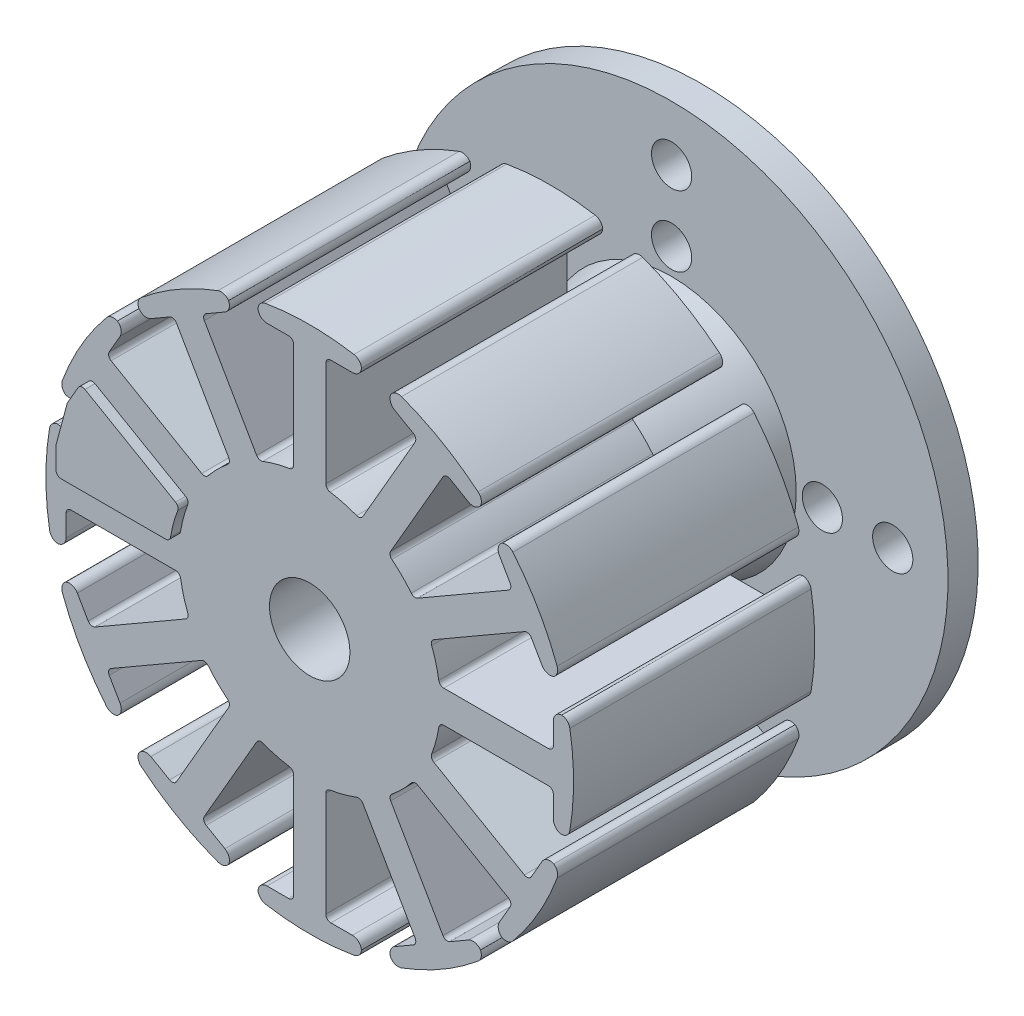
from build123d import *

# Parameters (mm, degrees)
SKETCH_1_R          = 4
EXTRUDE_1_DEPTH     = 24
FILLET_1_R          = 0.9
FILLET_2_R          = 0.9
FILLET_3_R          = 0.9
FILLET_4_R          = 0.9
FILLET_5_R          = 0.5
FILLET_6_R          = 0.5
SKETCH_6_R          = 27.5
EXTRUDE_3_DEPTH     = 3
CUT_EXTRUDE_1_REACH = 57.077
SKETCH_7_R          = 2
SKETCH_8_R          = 10.6
CUT_EXTRUDE_2_DEPTH = 1
SKETCH_9_R          = 4
CUT_EXTRUDE_3_DEPTH = 55.373706881
EXTRUDE_4_DEPTH     = 1


with BuildPart() as part:
    # ｽｹｯﾁ1 → ﾎﾞｽ - 押し出し1 (new body)
    with BuildSketch(Plane.XY):
        with BuildLine():
            Line((-1.6, 24.239852369), (-1.6, 12.901162738))
            ThreePointArc((-1.6, 12.901162738), (-3.364647586, 12.557035742), (-5.064940723, 11.97273467))
            Line((-5.064940723, 11.97273467), (-10.734285539, 21.792327936))
            Line((-10.734285539, 21.792327936), (-7.659895355, 23.567327936))
            Line((-7.659895355, 23.567327936), (-8.409895355, 24.866366042))
            ThreePointArc((-8.409895355, 24.866366042), (-13.125, 22.733166849), (-17.329957014, 19.716366042))
            Line((-17.329957014, 19.716366042), (-16.579957014, 18.417327936))
            Line((-16.579957014, 18.417327936), (-13.505566831, 20.192327936))
            Line((-13.505566831, 20.192327936), (-7.836222015, 10.37273467))
            ThreePointArc((-7.836222015, 10.37273467), (-9.192388155, 9.192388155), (-10.37273467, 7.836222015))
            Line((-10.37273467, 7.836222015), (-20.192327936, 13.505566831))
            Line((-20.192327936, 13.505566831), (-18.417327936, 16.579957014))
            Line((-18.417327936, 16.579957014), (-19.716366042, 17.329957014))
            ThreePointArc((-19.716366042, 17.329957014), (-22.733166849, 13.125), (-24.866366042, 8.409895355))
            Line((-24.866366042, 8.409895355), (-23.567327936, 7.659895355))
            Line((-23.567327936, 7.659895355), (-21.792327936, 10.734285539))
            Line((-21.792327936, 10.734285539), (-11.97273467, 5.064940723))
            ThreePointArc((-11.97273467, 5.064940723), (-12.557035742, 3.364647586), (-12.901162738, 1.6))
            Line((-12.901162738, 1.6), (-24.239852369, 1.6))
            Line((-24.239852369, 1.6), (-24.239852369, 5.15))
            Line((-24.239852369, 5.15), (-25.739852369, 5.15))
            ThreePointArc((-25.739852369, 5.15), (-26.25, 0), (-25.739852369, -5.15))
            Line((-25.739852369, -5.15), (-24.239852369, -5.15))
            Line((-24.239852369, -5.15), (-24.239852369, -1.6))
            Line((-24.239852369, -1.6), (-12.901162738, -1.6))
            ThreePointArc((-12.901162738, -1.6), (-12.557035742, -3.364647586), (-11.97273467, -5.064940723))
            Line((-11.97273467, -5.064940723), (-21.792327936, -10.734285539))
            Line((-21.792327936, -10.734285539), (-23.567327936, -7.659895355))
            Line((-23.567327936, -7.659895355), (-24.866366042, -8.409895355))
            ThreePointArc((-24.866366042, -8.409895355), (-22.733166849, -13.125), (-19.716366042, -17.329957014))
            Line((-19.716366042, -17.329957014), (-18.417327936, -16.579957014))
            Line((-18.417327936, -16.579957014), (-20.192327936, -13.505566831))
            Line((-20.192327936, -13.505566831), (-10.37273467, -7.836222015))
            ThreePointArc((-10.37273467, -7.836222015), (-9.192388155, -9.192388155), (-7.836222015, -10.37273467))
            Line((-7.836222015, -10.37273467), (-13.505566831, -20.192327936))
            Line((-13.505566831, -20.192327936), (-16.579957014, -18.417327936))
            Line((-16.579957014, -18.417327936), (-17.329957014, -19.716366042))
            ThreePointArc((-17.329957014, -19.716366042), (-13.125, -22.733166849), (-8.409895355, -24.866366042))
            Line((-8.409895355, -24.866366042), (-7.659895355, -23.567327936))
            Line((-7.659895355, -23.567327936), (-10.734285539, -21.792327936))
            Line((-10.734285539, -21.792327936), (-5.064940723, -11.97273467))
            ThreePointArc((-5.064940723, -11.97273467), (-3.364647586, -12.557035742), (-1.6, -12.901162738))
            Line((-1.6, -12.901162738), (-1.6, -24.239852369))
            Line((-1.6, -24.239852369), (-5.15, -24.239852369))
            Line((-5.15, -24.239852369), (-5.15, -25.739852369))
            ThreePointArc((-5.15, -25.739852369), (0, -26.25), (5.15, -25.739852369))
            Line((5.15, -25.739852369), (5.15, -24.239852369))
            Line((5.15, -24.239852369), (1.6, -24.239852369))
            Line((1.6, -24.239852369), (1.6, -12.901162738))
            ThreePointArc((1.6, -12.901162738), (3.364647586, -12.557035742), (5.064940723, -11.97273467))
            Line((5.064940723, -11.97273467), (10.734285539, -21.792327936))
            Line((10.734285539, -21.792327936), (7.659895355, -23.567327936))
            Line((7.659895355, -23.567327936), (8.409895355, -24.866366042))
            ThreePointArc((8.409895355, -24.866366042), (13.125, -22.733166849), (17.329957014, -19.716366042))
            Line((17.329957014, -19.716366042), (16.579957014, -18.417327936))
            Line((16.579957014, -18.417327936), (13.505566831, -20.192327936))
            Line((13.505566831, -20.192327936), (7.836222015, -10.37273467))
            ThreePointArc((7.836222015, -10.37273467), (9.192388155, -9.192388155), (10.37273467, -7.836222015))
            Line((10.37273467, -7.836222015), (20.192327936, -13.505566831))
            Line((20.192327936, -13.505566831), (18.417327936, -16.579957014))
            Line((18.417327936, -16.579957014), (19.716366042, -17.329957014))
            ThreePointArc((19.716366042, -17.329957014), (22.733166849, -13.125), (24.866366042, -8.409895355))
            Line((24.866366042, -8.409895355), (23.567327936, -7.659895355))
            Line((23.567327936, -7.659895355), (21.792327936, -10.734285539))
            Line((21.792327936, -10.734285539), (11.97273467, -5.064940723))
            ThreePointArc((11.97273467, -5.064940723), (12.557035742, -3.364647586), (12.901162738, -1.6))
            Line((12.901162738, -1.6), (24.239852369, -1.6))
            Line((24.239852369, -1.6), (24.239852369, -5.15))
            Line((24.239852369, -5.15), (25.739852369, -5.15))
            ThreePointArc((25.739852369, -5.15), (26.25, 0), (25.739852369, 5.15))
            Line((25.739852369, 5.15), (24.239852369, 5.15))
            Line((24.239852369, 5.15), (24.239852369, 1.6))
            Line((24.239852369, 1.6), (12.901162738, 1.6))
            ThreePointArc((12.901162738, 1.6), (12.557035742, 3.364647586), (11.97273467, 5.064940723))
            Line((11.97273467, 5.064940723), (21.792327936, 10.734285539))
            Line((21.792327936, 10.734285539), (23.567327936, 7.659895355))
            Line((23.567327936, 7.659895355), (24.866366042, 8.409895355))
            ThreePointArc((24.866366042, 8.409895355), (22.733166849, 13.125), (19.716366042, 17.329957014))
            Line((19.716366042, 17.329957014), (18.417327936, 16.579957014))
            Line((18.417327936, 16.579957014), (20.192327936, 13.505566831))
            Line((20.192327936, 13.505566831), (10.37273467, 7.836222015))
            ThreePointArc((10.37273467, 7.836222015), (9.192388155, 9.192388155), (7.836222015, 10.37273467))
            Line((7.836222015, 10.37273467), (13.505566831, 20.192327936))
            Line((13.505566831, 20.192327936), (16.579957014, 18.417327936))
            Line((16.579957014, 18.417327936), (17.329957014, 19.716366042))
            ThreePointArc((17.329957014, 19.716366042), (13.125, 22.733166849), (8.409895355, 24.866366042))
            Line((8.409895355, 24.866366042), (7.659895355, 23.567327936))
            Line((7.659895355, 23.567327936), (10.734285539, 21.792327936))
            Line((10.734285539, 21.792327936), (5.064940723, 11.97273467))
            ThreePointArc((5.064940723, 11.97273467), (3.364647586, 12.557035742), (1.6, 12.901162738))
            Line((1.6, 12.901162738), (1.6, 24.239852369))
            Line((1.6, 24.239852369), (5.15, 24.239852369))
            Line((5.15, 24.239852369), (5.15, 25.739852369))
            ThreePointArc((5.15, 25.739852369), (0, 26.25), (-5.15, 25.739852369))
            Line((-5.15, 25.739852369), (-5.15, 24.239852369))
            Line((-5.15, 24.239852369), (-1.6, 24.239852369))
        make_face()
        Circle(SKETCH_1_R, mode=Mode.SUBTRACT)
    extrude(amount=EXTRUDE_1_DEPTH)

    # ﾌｨﾚｯﾄ1
    # the kernel refuses this fillet: 0.9 mm, written as the material it takes off along each edge
    with BuildSketch(Plane(origin=(-16.579957014, 18.417327936, -2.25), x_dir=(-0.499999999999998, 0.8660254037844398, 0), z_dir=(0, 0, 1)), Plane(origin=(-7.659895355, 23.567327936, -2.25), x_dir=(-0.8660254037844388, -0.4999999999999998, 0), z_dir=(0, 0, 1))) as fillet_1_piece_1:
        with BuildLine():
            CenterArc((FILLET_1_R, -FILLET_1_R), FILLET_1_R, 90, 90)
            Line((0, -FILLET_1_R), (0, 0))
            Line((0, 0), (FILLET_1_R, 0))
        make_face()
    extrude(amount=28.5, mode=Mode.SUBTRACT)
    with BuildSketch(Plane(origin=(-17.329957014, 19.716366042, -1.904569315), x_dir=(0.7606005783965516, 0.6492201168654828, 0), z_dir=(0, 0, 1))) as fillet_1_piece_2:
        with BuildLine():
            CenterArc((0.748767822, -0.899905239), FILLET_1_R, 89.168551516, 80.34862068)
            Line((-0.136210711, -0.736158497), (0, 0))
            ThreePointArc((0, 0), (0.380913863, 0.002763867), (0.761827726, 0))
        make_face()
    extrude(amount=27.809138629, mode=Mode.SUBTRACT)
    with BuildSketch(Plane(origin=(-8.409895355, 24.866366042, -1.904569315), x_dir=(0.5000000000000019, -0.8660254037844376, 0), z_dir=(0, 0, 1))) as fillet_1_piece_3:
        with BuildLine():
            CenterArc((0.748653919, -0.9), FILLET_1_R, 90, 80.34862068)
            ThreePointArc((-0.138607565, -0.749112426), (-0.072021519, -0.374053353), (0, 0))
            Line((0, 0), (0.748653919, 0))
        make_face()
    extrude(amount=27.809138629, mode=Mode.SUBTRACT)

    # ﾌｨﾚｯﾄ2
    # the kernel refuses this fillet: 0.9 mm, written as the material it takes off along each edge
    with BuildSketch(Plane(origin=(23.567327936, 7.659895355, -2.25), x_dir=(0.8660254037844378, 0.5000000000000012, 0), z_dir=(0, 0, 1)), Plane(origin=(16.579957014, 18.417327936, -2.25), x_dir=(0.4999999999999998, 0.8660254037844388, 0), z_dir=(0, 0, 1)), Plane(origin=(18.417327936, 16.579957014, -2.25), x_dir=(0.4999999999999989, -0.8660254037844393, 0), z_dir=(0, 0, 1)), Plane(origin=(5.15, 24.239852369, -2.25), x_dir=(0, 1, 0), z_dir=(0, 0, 1)), Plane(origin=(7.659895355, 23.567327936, -2.25), x_dir=(0.866025403784439, -0.49999999999999933, 0), z_dir=(0, 0, 1))) as fillet_2_piece_1:
        with BuildLine():
            CenterArc((FILLET_2_R, FILLET_2_R), FILLET_2_R, 180, 90)
            Line((0, FILLET_2_R), (0, 0))
            Line((0, 0), (FILLET_2_R, 0))
        make_face()
    extrude(amount=28.5, mode=Mode.SUBTRACT)
    with BuildSketch(Plane(origin=(24.866366042, 8.409895355, -1.904569315), x_dir=(-0.33408936459181177, 0.9425414030516853, 0), z_dir=(0, 0, 1)), Plane(origin=(17.329957014, 19.716366042, -1.904569315), x_dir=(-0.7606005783965537, 0.6492201168654804, 0), z_dir=(0, 0, 1)), Plane(origin=(5.15, 25.739852369, -1.904569315), x_dir=(-0.9833094814572922, 0.1819408246551361, 0), z_dir=(0, 0, 1))) as fillet_2_piece_2:
        with BuildLine():
            CenterArc((0.748767822, 0.899905239), FILLET_2_R, 190.482827805, 80.34862068)
            Line((-0.136210711, 0.736158497), (0, 0))
            ThreePointArc((0, 0), (0.380913863, -0.002763867), (0.761827726, 0))
        make_face()
    extrude(amount=27.809138629, mode=Mode.SUBTRACT)
    with BuildSketch(Plane(origin=(19.716366042, 17.329957014, -1.904569315), x_dir=(-0.8660254037844389, -0.4999999999999996, 0), z_dir=(0, 0, 1)), Plane(origin=(8.409895355, 24.866366042, -1.904569315), x_dir=(-0.5000000000000033, -0.8660254037844366, 0), z_dir=(0, 0, 1)), Plane(origin=(-5.15, 25.739852369, -1.904569315), x_dir=(0, -1, 0), z_dir=(0, 0, 1))) as fillet_2_piece_3:
        with BuildLine():
            CenterArc((0.748653919, 0.9), FILLET_2_R, 189.65137932, 80.34862068)
            ThreePointArc((-0.138607565, 0.749112426), (-0.072021519, 0.374053353), (0, 0))
            Line((0, 0), (0.748653919, 0))
        make_face()
    extrude(amount=27.809138629, mode=Mode.SUBTRACT)
    with BuildSketch(Plane(origin=(-5.15, 24.239852369, -2.25), x_dir=(0, 1, 0), z_dir=(0, 0, 1))) as fillet_2_piece_4:
        with BuildLine():
            CenterArc((FILLET_2_R, -FILLET_2_R), FILLET_2_R, 90, 90)
            Line((0, -FILLET_2_R), (0, 0))
            Line((0, 0), (FILLET_2_R, 0))
        make_face()
    extrude(amount=28.5, mode=Mode.SUBTRACT)

    # ﾌｨﾚｯﾄ3
    # the kernel refuses this fillet: 0.9 mm, written as the material it takes off along each edge
    with BuildSketch(Plane(origin=(19.716366042, -17.329957014, -1.904569315), x_dir=(0.6492201168654783, 0.7606005783965555, 0), z_dir=(0, 0, 1)), Plane(origin=(25.739852369, -5.15, -1.904569315), x_dir=(0.1819408246551318, 0.9833094814572931, 0), z_dir=(0, 0, 1))) as fillet_3_piece_1:
        with BuildLine():
            CenterArc((0.748767822, 0.899905239), FILLET_3_R, 190.482827805, 80.34862068)
            Line((-0.136210711, 0.736158497), (0, 0))
            ThreePointArc((0, 0), (0.380913863, -0.002763867), (0.761827726, 0))
        make_face()
    extrude(amount=27.809138629, mode=Mode.SUBTRACT)
    with BuildSketch(Plane(origin=(18.417327936, -16.579957014, -2.25), x_dir=(0.8660254037844388, -0.4999999999999998, 0), z_dir=(0, 0, 1)), Plane(origin=(23.567327936, -7.659895355, -2.25), x_dir=(-0.499999999999998, -0.8660254037844398, 0), z_dir=(0, 0, 1)), Plane(origin=(24.239852369, 5.15, -2.25), x_dir=(0, -1, 0), z_dir=(0, 0, 1)), Plane(origin=(24.239852369, -5.15, -2.25), x_dir=(1, 0, 0), z_dir=(0, 0, 1))) as fillet_3_piece_2:
        with BuildLine():
            CenterArc((FILLET_3_R, FILLET_3_R), FILLET_3_R, 180, 90)
            Line((0, FILLET_3_R), (0, 0))
            Line((0, 0), (FILLET_3_R, 0))
        make_face()
    extrude(amount=28.5, mode=Mode.SUBTRACT)
    with BuildSketch(Plane(origin=(24.866366042, -8.409895355, -1.904569315), x_dir=(-0.8660254037844379, 0.5000000000000012, 0), z_dir=(0, 0, 1)), Plane(origin=(25.739852369, 5.15, -1.904569315), x_dir=(-1, 0, 0), z_dir=(0, 0, 1))) as fillet_3_piece_3:
        with BuildLine():
            CenterArc((0.748653919, 0.9), FILLET_3_R, 189.65137932, 80.34862068)
            ThreePointArc((-0.138607565, 0.749112426), (-0.072021519, 0.374053353), (0, 0))
            Line((0, 0), (0.748653919, 0))
        make_face()
    extrude(amount=27.809138629, mode=Mode.SUBTRACT)

    # ﾌｨﾚｯﾄ4
    # the kernel refuses this fillet: 0.9 mm, written as the material it takes off along each edge
    with BuildSketch(Plane(origin=(-19.716366042, 17.329957014, -1.904569315), x_dir=(-0.6492201168654804, -0.7606005783965537, 0), z_dir=(0, 0, 1)), Plane(origin=(-25.739852369, 5.15, -1.904569315), x_dir=(-0.1819408246551318, -0.9833094814572931, 0), z_dir=(0, 0, 1)), Plane(origin=(-24.866366042, -8.409895355, -1.904569315), x_dir=(0.33408936459180916, -0.9425414030516861, 0), z_dir=(0, 0, 1)), Plane(origin=(-17.329957014, -19.716366042, -1.904569315), x_dir=(0.7606005783965555, -0.6492201168654783, 0), z_dir=(0, 0, 1)), Plane(origin=(-5.15, -25.739852369, -1.904569315), x_dir=(0.9833094814572922, -0.1819408246551361, 0), z_dir=(0, 0, 1)), Plane(origin=(8.409895355, -24.866366042, -1.904569315), x_dir=(0.9425414030516851, 0.3340893645918125, 0), z_dir=(0, 0, 1))) as fillet_4_piece_1:
        with BuildLine():
            CenterArc((0.748767822, 0.899905239), FILLET_4_R, 190.482827805, 80.34862068)
            Line((-0.136210711, 0.736158497), (0, 0))
            ThreePointArc((0, 0), (0.380913863, -0.002763867), (0.761827726, 0))
        make_face()
    extrude(amount=27.809138629, mode=Mode.SUBTRACT)
    with BuildSketch(Plane(origin=(-18.417327936, 16.579957014, -2.25), x_dir=(-0.8660254037844388, 0.4999999999999998, 0), z_dir=(0, 0, 1)), Plane(origin=(-23.567327936, 7.659895355, -2.25), x_dir=(0.500000000000001, 0.866025403784438, 0), z_dir=(0, 0, 1)), Plane(origin=(-24.239852369, 5.15, -2.25), x_dir=(-1, 0, 0), z_dir=(0, 0, 1)), Plane(origin=(-24.239852369, -5.15, -2.25), x_dir=(0, 1, 0), z_dir=(0, 0, 1)), Plane(origin=(-23.567327936, -7.659895355, -2.25), x_dir=(-0.8660254037844375, -0.500000000000002, 0), z_dir=(0, 0, 1)), Plane(origin=(-18.417327936, -16.579957014, -2.25), x_dir=(-0.4999999999999989, 0.8660254037844393, 0), z_dir=(0, 0, 1)), Plane(origin=(-16.579957014, -18.417327936, -2.25), x_dir=(-0.4999999999999998, -0.8660254037844388, 0), z_dir=(0, 0, 1)), Plane(origin=(-7.659895355, -23.567327936, -2.25), x_dir=(-0.8660254037844395, 0.49999999999999845, 0), z_dir=(0, 0, 1)), Plane(origin=(-5.15, -24.239852369, -2.25), x_dir=(0, -1, 0), z_dir=(0, 0, 1)), Plane(origin=(5.15, -24.239852369, -2.25), x_dir=(-1, 0, 0), z_dir=(0, 0, 1)), Plane(origin=(7.659895355, -23.567327936, -2.25), x_dir=(0.5000000000000002, -0.8660254037844385, 0), z_dir=(0, 0, 1)), Plane(origin=(16.579957014, -18.417327936, -2.25), x_dir=(-0.8660254037844393, -0.4999999999999989, 0), z_dir=(0, 0, 1))) as fillet_4_piece_2:
        with BuildLine():
            CenterArc((FILLET_4_R, FILLET_4_R), FILLET_4_R, 180, 90)
            Line((0, FILLET_4_R), (0, 0))
            Line((0, 0), (FILLET_4_R, 0))
        make_face()
    extrude(amount=28.5, mode=Mode.SUBTRACT)
    with BuildSketch(Plane(origin=(-24.866366042, 8.409895355, -1.904569315), x_dir=(0.8660254037844375, -0.5000000000000019, 0), z_dir=(0, 0, 1)), Plane(origin=(-25.739852369, -5.15, -1.904569315), x_dir=(1, 0, 0), z_dir=(0, 0, 1)), Plane(origin=(-19.716366042, -17.329957014, -1.904569315), x_dir=(0.8660254037844376, 0.5000000000000019, 0), z_dir=(0, 0, 1)), Plane(origin=(-8.409895355, -24.866366042, -1.904569315), x_dir=(0.5000000000000003, 0.8660254037844384, 0), z_dir=(0, 0, 1)), Plane(origin=(5.15, -25.739852369, -1.904569315), x_dir=(0, 1, 0), z_dir=(0, 0, 1)), Plane(origin=(17.329957014, -19.716366042, -1.904569315), x_dir=(-0.5000000000000003, 0.8660254037844385, 0), z_dir=(0, 0, 1))) as fillet_4_piece_3:
        with BuildLine():
            CenterArc((0.748653919, 0.9), FILLET_4_R, 189.65137932, 80.34862068)
            ThreePointArc((-0.138607565, 0.749112426), (-0.072021519, 0.374053353), (0, 0))
            Line((0, 0), (0.748653919, 0))
        make_face()
    extrude(amount=27.809138629, mode=Mode.SUBTRACT)

    # ﾌｨﾚｯﾄ5
    fillet_5_edges = [part.edges().sort_by_distance(p)[0] for p in [
        (21.792327936, 10.734285539, 12),
        (11.97273467, 5.064940723, 12),
        (12.901162738, 1.6, 12),
        (24.239852369, 1.6, 12),
        (24.239852369, -1.6, 12),
        (12.901162738, -1.6, 12),
        (11.97273467, -5.064940723, 12),
        (21.792327936, -10.734285539, 12),
        (20.192327936, -13.505566831, 12),
        (10.37273467, -7.836222015, 12),
        (7.836222015, -10.37273467, 12),
        (13.505566831, -20.192327936, 12),
        (10.734285539, -21.792327936, 12),
        (5.064940723, -11.97273467, 12),
        (1.6, -12.901162738, 12),
        (1.6, -24.239852369, 12),
        (-1.6, -24.239852369, 12),
        (-1.6, -12.901162738, 12),
        (-5.064940723, -11.97273467, 12),
        (-10.734285539, -21.792327936, 12),
        (-13.505566831, -20.192327936, 12),
        (-7.836222015, -10.37273467, 12),
        (-10.37273467, -7.836222015, 12),
        (-20.192327936, -13.505566831, 12),
        (-21.792327936, -10.734285539, 12),
        (-11.97273467, -5.064940723, 12),
    ]]
    fillet(fillet_5_edges, radius=FILLET_5_R)

    # ﾌｨﾚｯﾄ6
    fillet_6_edges = [part.edges().sort_by_distance(p)[0] for p in [
        (1.6, 24.239852369, 12),
        (1.6, 12.901162738, 12),
        (5.064940723, 11.97273467, 12),
        (10.734285539, 21.792327936, 12),
        (13.505566831, 20.192327936, 12),
        (7.836222015, 10.37273467, 12),
        (10.37273467, 7.836222015, 12),
        (20.192327936, 13.505566831, 12),
        (-12.901162738, -1.6, 12),
        (-24.239852369, -1.6, 12),
        (-24.239852369, 1.6, 12),
        (-12.901162738, 1.6, 12),
        (-11.97273467, 5.064940723, 12),
        (-21.792327936, 10.734285539, 12),
        (-20.192327936, 13.505566831, 12),
        (-10.37273467, 7.836222015, 12),
        (-7.836222015, 10.37273467, 12),
        (-13.505566831, 20.192327936, 12),
        (-10.734285539, 21.792327936, 12),
        (-5.064940723, 11.97273467, 12),
        (-1.6, 12.901162738, 12),
        (-1.6, 24.239852369, 12),
    ]]
    fillet(fillet_6_edges, radius=FILLET_6_R)

    # ｽｹｯﾁ5 → 回転1 (revolve)
    with BuildSketch(Plane(origin=(0, 0, 0), x_dir=(0, 0, -1), z_dir=(1, 0, 0)), mode=Mode.PRIVATE) as revolve_1_sk:
        Polygon((0, 0), (15, 0), (15, 13), (0, 10), align=None)
    revolve(revolve_1_sk.sketch.rotate(Axis((0, 0, 0), (0, 0, -1)), 90), axis=Axis((0, 0, 0), (0, 0, -1)))

    # ｽｹｯﾁ6 → ﾎﾞｽ - 押し出し3 (add)
    with BuildSketch(Plane(origin=(0, 0, -15), x_dir=(-1, 0, 0), z_dir=(0, 0, -1))):
        Circle(SKETCH_6_R)
    extrude(amount=-EXTRUDE_3_DEPTH)

    # ｽｹｯﾁ7 → ｶｯﾄ - 押し出し1 (cut, up to next)
    with BuildSketch(Plane(origin=(0, 0, -15), x_dir=(-1, 0, 0), z_dir=(0, 0, -1)), mode=Mode.PRIVATE) as cut_extrude_1_sk1:
        with Locations((0, 22)):
            Circle(SKETCH_7_R)
    cut_extrude_1_tool1 = extrude(cut_extrude_1_sk1.sketch, amount=-CUT_EXTRUDE_1_REACH, mode=Mode.PRIVATE) & part.part
    # ｽｹｯﾁ7 → ｶｯﾄ - 押し出し1 (cut, up to next)
    with BuildSketch(Plane(origin=(0, 0, -15), x_dir=(-1, 0, 0), z_dir=(0, 0, -1)), mode=Mode.PRIVATE) as cut_extrude_1_sk2:
        with Locations((0, 15)):
            Circle(SKETCH_7_R)
    cut_extrude_1_tool2 = extrude(cut_extrude_1_sk2.sketch, amount=-CUT_EXTRUDE_1_REACH, mode=Mode.PRIVATE) & part.part
    # ｽｹｯﾁ7 → ｶｯﾄ - 押し出し1 (cut, up to next)
    with BuildSketch(Plane(origin=(0, 0, -15), x_dir=(-1, 0, 0), z_dir=(0, 0, -1)), mode=Mode.PRIVATE) as cut_extrude_1_sk3:
        with Locations((15, 0)):
            Circle(SKETCH_7_R)
    cut_extrude_1_tool3 = extrude(cut_extrude_1_sk3.sketch, amount=-CUT_EXTRUDE_1_REACH, mode=Mode.PRIVATE) & part.part
    # ｽｹｯﾁ7 → ｶｯﾄ - 押し出し1 (cut, up to next)
    with BuildSketch(Plane(origin=(0, 0, -15), x_dir=(-1, 0, 0), z_dir=(0, 0, -1)), mode=Mode.PRIVATE) as cut_extrude_1_sk4:
        with Locations((22, 0)):
            Circle(SKETCH_7_R)
    cut_extrude_1_tool4 = extrude(cut_extrude_1_sk4.sketch, amount=-CUT_EXTRUDE_1_REACH, mode=Mode.PRIVATE) & part.part
    # ｽｹｯﾁ7 → ｶｯﾄ - 押し出し1 (cut, up to next)
    with BuildSketch(Plane(origin=(0, 0, -15), x_dir=(-1, 0, 0), z_dir=(0, 0, -1)), mode=Mode.PRIVATE) as cut_extrude_1_sk5:
        with Locations((-22, 0)):
            Circle(SKETCH_7_R)
    cut_extrude_1_tool5 = extrude(cut_extrude_1_sk5.sketch, amount=-CUT_EXTRUDE_1_REACH, mode=Mode.PRIVATE) & part.part
    # ｽｹｯﾁ7 → ｶｯﾄ - 押し出し1 (cut, up to next)
    with BuildSketch(Plane(origin=(0, 0, -15), x_dir=(-1, 0, 0), z_dir=(0, 0, -1)), mode=Mode.PRIVATE) as cut_extrude_1_sk6:
        with Locations((-15, 0)):
            Circle(SKETCH_7_R)
    cut_extrude_1_tool6 = extrude(cut_extrude_1_sk6.sketch, amount=-CUT_EXTRUDE_1_REACH, mode=Mode.PRIVATE) & part.part
    # ｽｹｯﾁ7 → ｶｯﾄ - 押し出し1 (cut, up to next)
    with BuildSketch(Plane(origin=(0, 0, -15), x_dir=(-1, 0, 0), z_dir=(0, 0, -1)), mode=Mode.PRIVATE) as cut_extrude_1_sk7:
        with Locations((0, -15)):
            Circle(SKETCH_7_R)
    cut_extrude_1_tool7 = extrude(cut_extrude_1_sk7.sketch, amount=-CUT_EXTRUDE_1_REACH, mode=Mode.PRIVATE) & part.part
    # ｽｹｯﾁ7 → ｶｯﾄ - 押し出し1 (cut, up to next)
    with BuildSketch(Plane(origin=(0, 0, -15), x_dir=(-1, 0, 0), z_dir=(0, 0, -1)), mode=Mode.PRIVATE) as cut_extrude_1_sk8:
        with Locations((0, -22)):
            Circle(SKETCH_7_R)
    cut_extrude_1_tool8 = extrude(cut_extrude_1_sk8.sketch, amount=-CUT_EXTRUDE_1_REACH, mode=Mode.PRIVATE) & part.part
    add(cut_extrude_1_tool1.solids().sort_by_distance((0, 22, -15))[0], mode=Mode.SUBTRACT)
    add(cut_extrude_1_tool2.solids().sort_by_distance((0, 15, -15))[0], mode=Mode.SUBTRACT)
    add(cut_extrude_1_tool3.solids().sort_by_distance((-15, 0, -15))[0], mode=Mode.SUBTRACT)
    add(cut_extrude_1_tool4.solids().sort_by_distance((-22, 0, -15))[0], mode=Mode.SUBTRACT)
    add(cut_extrude_1_tool5.solids().sort_by_distance((22, 0, -15))[0], mode=Mode.SUBTRACT)
    add(cut_extrude_1_tool6.solids().sort_by_distance((15, 0, -15))[0], mode=Mode.SUBTRACT)
    add(cut_extrude_1_tool7.solids().sort_by_distance((0, -15, -15))[0], mode=Mode.SUBTRACT)
    add(cut_extrude_1_tool8.solids().sort_by_distance((0, -22, -15))[0], mode=Mode.SUBTRACT)

    # ｽｹｯﾁ8 → ｶｯﾄ - 押し出し2 (cut)
    with BuildSketch(Plane(origin=(0, 0, -15), x_dir=(-1, 0, 0), z_dir=(0, 0, -1))):
        Circle(SKETCH_8_R)
    extrude(amount=-CUT_EXTRUDE_2_DEPTH, mode=Mode.SUBTRACT)

    # ｽｹｯﾁ9 → ｶｯﾄ - 押し出し3 (cut, through all)
    with BuildSketch(Plane(origin=(0, 0, -14), x_dir=(-1, 0, 0), z_dir=(0, 0, -1))):
        Circle(SKETCH_9_R)
    extrude(amount=-CUT_EXTRUDE_3_DEPTH, mode=Mode.SUBTRACT)


with BuildPart() as body_2:
    # ｽｹｯﾁ10 → ﾎﾞｽ - 押し出し4 (new body)
    with BuildSketch(Plane.XY.offset(24)):
        with BuildLine():
            Line((-24.239852369, 2.1), (-24.239852369, 4.25))
            Line((-24.239852369, 4.25), (-23.117327936, 8.439318219))
            Line((-23.117327936, 8.439318219), (-22.042327936, 10.301272837))
            ThreePointArc((-22.042327936, 10.301272837), (-21.738724757, 10.53423575), (-21.359315234, 10.484285539))
            Line((-21.359315234, 10.484285539), (-12.349025933, 5.282192585))
            ThreePointArc((-12.349025933, 5.282192585), (-12.127630979, 5.015873605), (-12.132395343, 4.669580628))
            ThreePointArc((-12.132395343, 4.669580628), (-12.557035742, 3.364647586), (-12.84175289, 2.022222222))
            ThreePointArc((-12.84175289, 2.022222222), (-13.010773318, 1.719941525), (-13.335666463, 1.6))
            Line((-13.335666463, 1.6), (-23.739852369, 1.6))
            ThreePointArc((-23.739852369, 1.6), (-24.09340576, 1.746446609), (-24.239852369, 2.1))
        make_face()
    extrude(amount=EXTRUDE_4_DEPTH)


solid = Compound([part.part, body_2.part])
